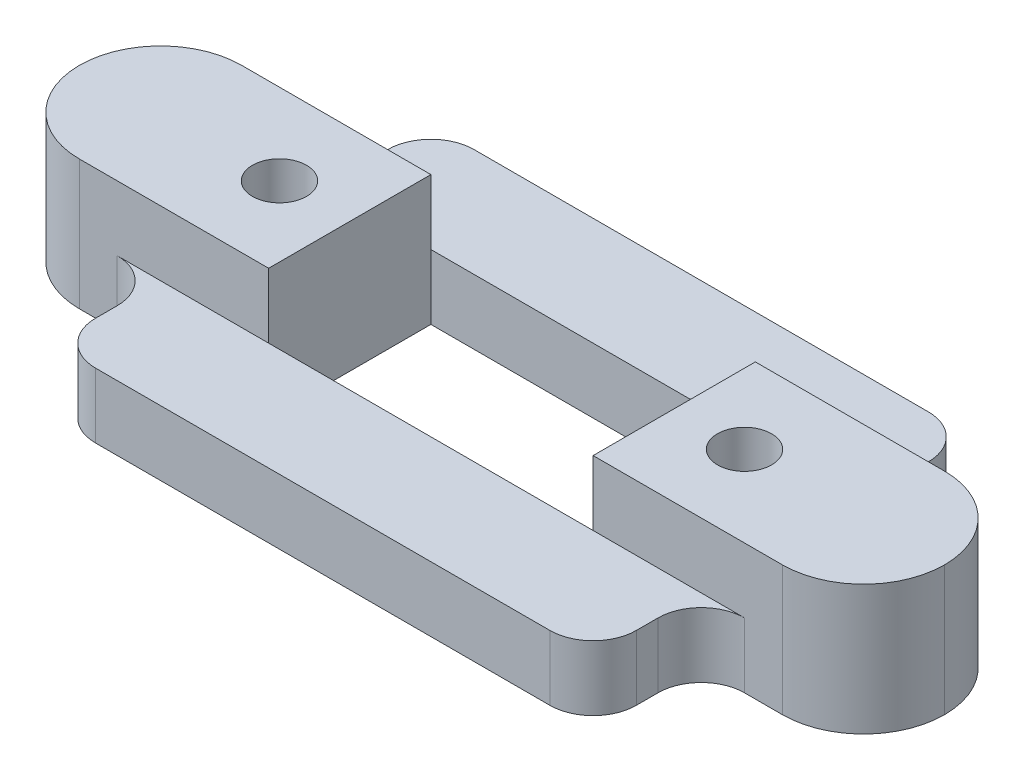
from build123d import *

# Parameters (mm, degrees)
SKETCH1_W               = 15
SKETCH1_H               = 7.5
BOSS_EXTRUDE1_DEPTH     = 6
SKETCH2_R               = 1.25
CUT_EXTRUDE1_DEPTH      = 6
FILLET1_R               = 3.75
CUT_EXTRUDE2_DEPTH      = 23.639843197
CUT_EXTRUDE2_DEPTH_BACK = 23.639843197
SKETCH3_W               = 5
SKETCH3_H               = 3
FILLET2_R               = 2


with BuildPart() as part:
    # Sketch1 → Boss-Extrude1 (new body)
    with BuildSketch(Plane(origin=(0, 0, 0), x_dir=(1, 0, 0), z_dir=(0, 1, 0))):
        Polygon((-20, 3.75), (-12.5, 3.75), (-12.5, 8.75), (12.5, 8.75), (12.5, 3.75), (20, 3.75), (20, -3.75), (12.5, -3.75), (12.5, -8.75), (-12.5, -8.75), (-12.5, -3.75), (-20, -3.75), align=None)
        Rectangle(SKETCH1_W, SKETCH1_H, mode=Mode.SUBTRACT)
    extrude(amount=BOSS_EXTRUDE1_DEPTH)

    # Sketch2 → Cut-Extrude1 (cut)
    with BuildSketch(Plane(origin=(0, 0, 0), x_dir=(1, 0, 0), z_dir=(0, 1, 0))):
        with Locations(Location((-10.75, 0, 0), (0, 0, 270))):
            Circle(SKETCH2_R)
        with Locations(Location((10.75, 0, 0), (0, 0, 90))):
            Circle(SKETCH2_R)
    extrude(amount=CUT_EXTRUDE1_DEPTH, mode=Mode.SUBTRACT)

    # Fillet1
    fillet1_edges = [part.edges().sort_by_distance(p)[0] for p in [
        (-20, 3, 3.75),
        (-20, 3, -3.75),
        (20, 3, 3.75),
        (20, 3, -3.75),
    ]]
    fillet(fillet1_edges, radius=FILLET1_R - 0.0001)  # a hair under: the kernel refuses the full size

    # Sketch3 → Cut-Extrude2 (cut, two sides: drawn at the far end of the back side and taken through both)
    with BuildSketch(Plane(origin=(0, 0, 0), x_dir=(0, 0, -1), z_dir=(1, 0, 0)).offset(-CUT_EXTRUDE2_DEPTH_BACK)):
        with Locations((6.25, 4.5)):
            Rectangle(SKETCH3_W, SKETCH3_H)
        with Locations((-6.25, 4.5)):
            Rectangle(SKETCH3_W, SKETCH3_H)
    extrude(amount=CUT_EXTRUDE2_DEPTH + CUT_EXTRUDE2_DEPTH_BACK, mode=Mode.SUBTRACT)

    # Fillet2
    fillet2_edges = [part.edges().sort_by_distance(p)[0] for p in [
        (12.5, 1.5, 3.75),
        (12.5, 1.5, 8.75),
        (-12.5, 1.5, 8.75),
        (-12.5, 1.5, 3.75),
        (-12.5, 1.5, -3.75),
        (-12.5, 1.5, -8.75),
        (12.5, 1.5, -8.75),
        (12.5, 1.5, -3.75),
    ]]
    fillet(fillet2_edges, radius=FILLET2_R)


solid = part.part
